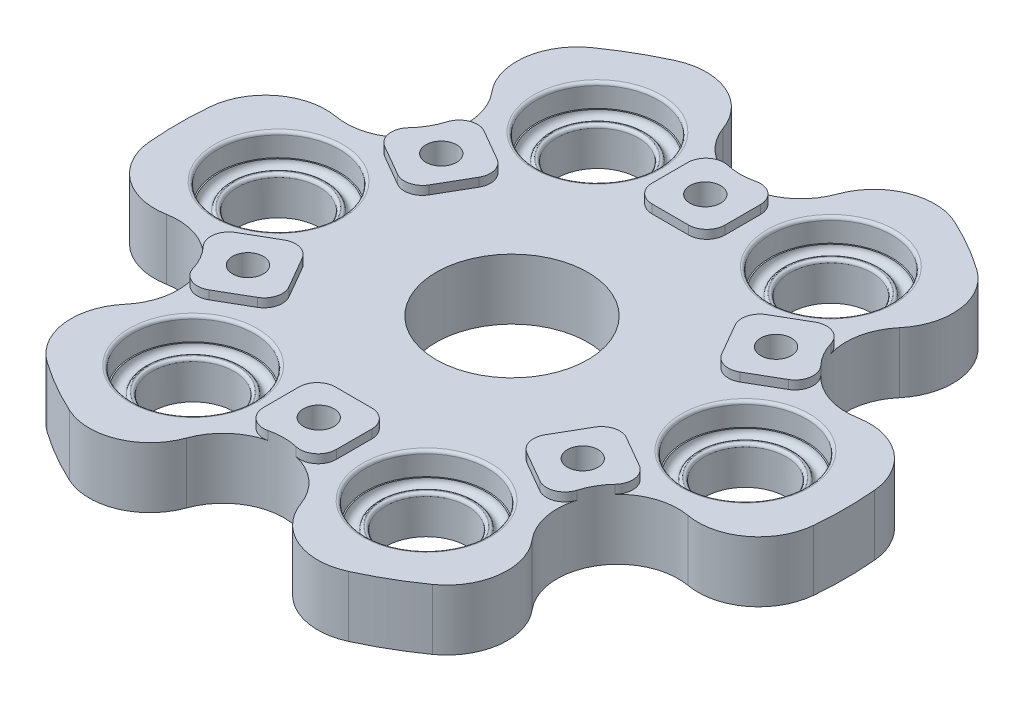
from build123d import *

# Parameters (mm, degrees)
SKETCH1_R                = 55
BOSS_EXTRUDE1_DEPTH      = 10
FILLET1_R                = 0.5
SKETCH5_R                = 10.000000000000005
SKETCH5_R_2              = 10.000000000000002
SKETCH5_R_3              = 12.5
CUT_EXTRUDE1_DEPTH       = 10
FILLET2_R                = 10
BOSS_EXTRUDE2_START      = 1.43
BOSS_EXTRUDE2_DEPTH      = 1.43
CUT_EXTRUDE2_DEPTH       = 3.5
FILLET3_R                = 3
CIRPATTERN1_COUNT        = 6
FILLET3_OF_CIRPATTERN1_R = 3


# Read off the part's stored shape, not the designer's step: Sketch-Pattern1
with BuildPart() as part:
    # Sketch1 → Boss-Extrude1 (new body)
    with BuildSketch(Plane(origin=(0, 0, 0), x_dir=(1, 0, 0), z_dir=(0, 1, 0))):
        with Locations(Location((0, 0, 0), (0, 0, 270))):
            Circle(SKETCH1_R)
    extrude(amount=BOSS_EXTRUDE1_DEPTH)

    # Sketch3 → Cut-Revolve3 (revolve, cut)
    with BuildSketch(Plane(origin=(19.247414599109128, 0, 0), x_dir=(0, 0, -1), z_dir=(1, 0, 0))):
        with BuildLine():
            Line((-33.33749999999999, 10), (-33.33749999999999, -2.082e-14))
            Line((-33.33749999999999, -2.082e-14), (-40.087499999999984, 3.47e-15))
            Line((-40.087499999999984, 3.47e-15), (-40.087499999999984, 6.25))
            Line((-40.087499999999984, 6.25), (-41.087499999999984, 6.25))
            ThreePointArc((-41.087499999999984, 6.25), (-42.13749999999998, 5.199999999999996), (-43.187499999999986, 6.25))
            Line((-43.187499999999986, 6.25), (-43.38749999999998, 6.249999999999999))
            Line((-43.38749999999998, 6.249999999999999), (-43.38749999999999, 10))
            Line((-43.38749999999999, 10), (-40.087499999999984, 9.999999999999972))
            Line((-40.087499999999984, 9.999999999999972), (-33.33749999999999, 10))
        make_face()
    revolve(axis=Axis((19.247414599109128, 10, 33.33749999999999), (0, -1, 0)), mode=Mode.SUBTRACT)

    # Fillet1
    fillet1_edges = [part.edges().sort_by_distance(p)[0] for p in [
        (19.247414599109128, 10, 23.287499999999994),
        (19.247414599109128, 6.25, 25.5875),
        (19.247414599109128, 6.25, 26.5875),
    ]]
    fillet(fillet1_edges, radius=FILLET1_R)

    # Sketch-Pattern1 outline → Sketch-Pattern1 (revolve, cut)
    with BuildSketch(Plane(origin=(-19.247414599, 0, -33.3375), x_dir=(1, 0, 0), z_dir=(0, 0, 1))):
        with BuildLine():
            ThreePointArc((7.806130917, 5.911290323), (8.97166459, 5.214127774), (9.85, 6.25))
            Line((9.85, 6.25), (10.05, 6.25))
            Line((10.05, 6.25), (10.05, 9.5))
            ThreePointArc((10.05, 9.5), (10.196446609, 9.853553391), (10.55, 10))
            Line((10.55, 10), (0, 10))
            Line((0, 10), (0, 0))
            Line((0, 0), (6.75, 0))
            Line((6.75, 0), (6.75, 5.75))
            ThreePointArc((6.75, 5.75), (6.896446609, 6.103553391), (7.25, 6.25))
            Line((7.25, 6.25), (7.332859925, 6.25))
            ThreePointArc((7.332859925, 6.25), (7.623853773, 6.156598796), (7.806130917, 5.911290323))
        make_face()
    revolve(axis=Axis((-19.247414599, 0, -33.3375), (0, 1, 0)), mode=Mode.SUBTRACT)

    # Sketch-Pattern1 2 outline → Sketch-Pattern1 2 (revolve, cut)
    with BuildSketch(Plane(origin=(19.247414599, 0, -33.3375), x_dir=(1, 0, 0), z_dir=(0, 0, 1))):
        with BuildLine():
            ThreePointArc((7.806130917, 5.911290323), (8.97166459, 5.214127774), (9.85, 6.25))
            Line((9.85, 6.25), (10.05, 6.25))
            Line((10.05, 6.25), (10.05, 9.5))
            ThreePointArc((10.05, 9.5), (10.196446609, 9.853553391), (10.55, 10))
            Line((10.55, 10), (0, 10))
            Line((0, 10), (0, 0))
            Line((0, 0), (6.75, 0))
            Line((6.75, 0), (6.75, 5.75))
            ThreePointArc((6.75, 5.75), (6.896446609, 6.103553391), (7.25, 6.25))
            Line((7.25, 6.25), (7.332859925, 6.25))
            ThreePointArc((7.332859925, 6.25), (7.623853773, 6.156598796), (7.806130917, 5.911290323))
        make_face()
    revolve(axis=Axis((19.247414599, 0, -33.3375), (0, 1, 0)), mode=Mode.SUBTRACT)

    # Sketch-Pattern1 3 outline → Sketch-Pattern1 3 (revolve, cut)
    with BuildSketch(Plane(origin=(38.494829198, 0, 0), x_dir=(1, 0, 0), z_dir=(0, 0, 1))):
        with BuildLine():
            ThreePointArc((7.806130917, 5.911290323), (8.97166459, 5.214127774), (9.85, 6.25))
            Line((9.85, 6.25), (10.05, 6.25))
            Line((10.05, 6.25), (10.05, 9.5))
            ThreePointArc((10.05, 9.5), (10.196446609, 9.853553391), (10.55, 10))
            Line((10.55, 10), (0, 10))
            Line((0, 10), (0, 0))
            Line((0, 0), (6.75, 0))
            Line((6.75, 0), (6.75, 5.75))
            ThreePointArc((6.75, 5.75), (6.896446609, 6.103553391), (7.25, 6.25))
            Line((7.25, 6.25), (7.332859925, 6.25))
            ThreePointArc((7.332859925, 6.25), (7.623853773, 6.156598796), (7.806130917, 5.911290323))
        make_face()
    revolve(axis=Axis((38.494829198, 0, 0), (0, 1, 0)), mode=Mode.SUBTRACT)

    # Sketch-Pattern1 4 outline → Sketch-Pattern1 4 (revolve, cut)
    with BuildSketch(Plane(origin=(-19.247414599, 0, 33.3375), x_dir=(1, 0, 0), z_dir=(0, 0, 1))):
        with BuildLine():
            ThreePointArc((7.806130917, 5.911290323), (8.97166459, 5.214127774), (9.85, 6.25))
            Line((9.85, 6.25), (10.05, 6.25))
            Line((10.05, 6.25), (10.05, 9.5))
            ThreePointArc((10.05, 9.5), (10.196446609, 9.853553391), (10.55, 10))
            Line((10.55, 10), (0, 10))
            Line((0, 10), (0, 0))
            Line((0, 0), (6.75, 0))
            Line((6.75, 0), (6.75, 5.75))
            ThreePointArc((6.75, 5.75), (6.896446609, 6.103553391), (7.25, 6.25))
            Line((7.25, 6.25), (7.332859925, 6.25))
            ThreePointArc((7.332859925, 6.25), (7.623853773, 6.156598796), (7.806130917, 5.911290323))
        make_face()
    revolve(axis=Axis((-19.247414599, 0, 33.3375), (0, 1, 0)), mode=Mode.SUBTRACT)

    # Sketch-Pattern1 5 outline → Sketch-Pattern1 5 (revolve, cut)
    with BuildSketch(Plane(origin=(-38.494829198, 0, 0), x_dir=(1, 0, 0), z_dir=(0, 0, 1))):
        with BuildLine():
            ThreePointArc((7.806130917, 5.911290323), (8.97166459, 5.214127774), (9.85, 6.25))
            Line((9.85, 6.25), (10.05, 6.25))
            Line((10.05, 6.25), (10.05, 9.5))
            ThreePointArc((10.05, 9.5), (10.196446609, 9.853553391), (10.55, 10))
            Line((10.55, 10), (0, 10))
            Line((0, 10), (0, 0))
            Line((0, 0), (6.75, 0))
            Line((6.75, 0), (6.75, 5.75))
            ThreePointArc((6.75, 5.75), (6.896446609, 6.103553391), (7.25, 6.25))
            Line((7.25, 6.25), (7.332859925, 6.25))
            ThreePointArc((7.332859925, 6.25), (7.623853773, 6.156598796), (7.806130917, 5.911290323))
        make_face()
    revolve(axis=Axis((-38.494829198, 0, 0), (0, 1, 0)), mode=Mode.SUBTRACT)

    # Sketch5 → Cut-Extrude1 (cut)
    with BuildSketch(Plane(origin=(0, 10, 0), x_dir=(1, 0, 0), z_dir=(0, 1, 0))):
        with Locations((1.392e-14, 47.625)):
            Circle(SKETCH5_R)
        with Locations((-41.244459855233885, 23.812500000000014)):
            Circle(SKETCH5_R_2)
        with Locations((-41.244459855233885, -23.812499999999986)):
            Circle(SKETCH5_R_2)
        with Locations((-2.084e-14, -47.625)):
            Circle(SKETCH5_R)
        with Locations((41.24445985523388, -23.81250000000002)):
            Circle(SKETCH5_R_2)
        with Locations((41.24445985523388, 23.812500000000007)):
            Circle(SKETCH5_R_2)
        with Locations(Location((0, 0, 0), (0, 0, 270))):
            Circle(SKETCH5_R_3)
    extrude(amount=-CUT_EXTRUDE1_DEPTH, mode=Mode.SUBTRACT)

    # Fillet2
    fillet2_edges = [part.edges().sort_by_distance(p)[0] for p in [
        (7.241751011062745, 5, -54.52116141732284),
        (-7.241751011062713, 5, -54.52116141732284),
        (50.837586336764886, 5, -20.989040365199546),
        (43.59583532570225, 5, -33.53212105212332),
        (43.59583532570218, 5, 33.53212105212341),
        (50.837586336764915, 5, 20.989040365199482),
        (-7.241751011062753, 5, 54.52116141732284),
        (7.241751011062706, 5, 54.52116141732284),
        (-50.83758633676489, 5, 20.989040365199525),
        (-43.595835325702254, 5, 33.5321210521233),
        (-43.59583532570219, 5, -33.5321210521234),
        (-50.83758633676492, 5, -20.989040365199475),
    ]]
    fillet(fillet2_edges, radius=FILLET2_R)

    # Sketch6 → Boss-Extrude2 (add)
    with BuildSketch(Plane(origin=(0, 10, 0), x_dir=(1, 0, 0), z_dir=(0, 1, 0)).offset(BOSS_EXTRUDE2_START)):
        with BuildLine():
            Line((-5.999999999999988, 39.62499999999999), (-5.999999999999987, 26.124999999999996))
            Line((-5.999999999999987, 26.124999999999996), (6.000000000000014, 26.124999999999996))
            Line((6.000000000000014, 26.124999999999996), (6.000000000000016, 39.62499999999999))
            ThreePointArc((6.000000000000016, 39.62499999999999), (1.453e-14, 37.62499999999999), (-5.999999999999988, 39.62499999999999))
        make_face()
    boss_extrude2 = extrude(amount=-BOSS_EXTRUDE2_DEPTH)

    # Sketch8 → #8 (0.199) Diameter Hole1 (revolve, cut)
    with BuildSketch(Plane(origin=(1.298e-14, 11.43, -31.874999999999993), x_dir=(0, 0, 1), z_dir=(1, 0, 0))):
        Polygon((0, 0), (-3.47e-15, 15), (2.5272999999999968, 13.481444957531645), (2.5272999999999985, 1e-16), align=None)
    f_8_0_199_diameter_hole1 = revolve(axis=Axis((1.298e-14, 17.77999999999999, -31.874999999999993), (0, -1, 0)), mode=Mode.SUBTRACT)

    # Sketch9 → Cut-Extrude2 (cut)
    with BuildSketch(Plane.XZ):
        Polygon((2.5836424546235937, -36.349999999999994), (5.167284909247167, -31.875), (2.5836424546235865, -27.399999999999995), (-2.5836424546235617, -27.399999999999995), (-5.167284909247135, -31.874999999999993), (-2.5836424546235577, -36.349999999999994), align=None)
    cut_extrude2 = extrude(amount=-CUT_EXTRUDE2_DEPTH, mode=Mode.SUBTRACT)

    # Fillet3
    fillet3_edges = [part.edges().sort_by_distance(p)[0] for p in [
        (6.000000000000016, 10.715, -39.62499999999999),
        (-5.999999999999988, 10.715, -39.62499999999999),
        (-5.999999999999987, 10.715, -26.124999999999996),
        (6.000000000000014, 10.715, -26.124999999999996),
    ]]
    fillet(fillet3_edges, radius=FILLET3_R)

    # CirPattern1: Boss-Extrude2, #8 (0.199) Diameter Hole1, Cut-Extrude2 ×6 about axis
    cirpattern1_axis = Axis((-3.306e-14, 0, 5.35e-15), (0, 1, 0))
    add([boss_extrude2.rotate(cirpattern1_axis, i * 360 / CIRPATTERN1_COUNT) for i in range(1, CIRPATTERN1_COUNT)])
    add([f_8_0_199_diameter_hole1.rotate(cirpattern1_axis, i * 360 / CIRPATTERN1_COUNT) for i in range(1, CIRPATTERN1_COUNT)], mode=Mode.SUBTRACT)
    add([cut_extrude2.rotate(cirpattern1_axis, i * 360 / CIRPATTERN1_COUNT) for i in range(1, CIRPATTERN1_COUNT)], mode=Mode.SUBTRACT)

    # Fillet3 of CirPattern1
    fillet3_of_cirpattern1_edges = [part.edges().sort_by_distance(p)[0] for p in [
        (-31.316256624958385, 10.715, -25.00865242270667),
        (-37.316256624958385, 10.715, -14.616347577293405),
        (-25.62491367386847, 10.715, -7.866347577293407),
        (-19.62491367386847, 10.715, -18.25865242270667),
        (-37.31625662495844, 10.715, 14.616347577293322),
        (-31.316256624958438, 10.715, 25.00865242270659),
        (-19.62491367386852, 10.715, 18.258652422706593),
        (-25.62491367386852, 10.715, 7.866347577293328),
        (-6.000000000000086, 10.715, 39.62500000000001),
        (5.999999999999917, 10.715, 39.62500000000001),
        (5.999999999999917, 10.715, 26.125000000000007),
        (-6.0000000000000835, 10.715, 26.125000000000007),
        (31.316256624958307, 10.715, 25.008652422706696),
        (37.316256624958314, 10.715, 14.616347577293432),
        (25.6249136738684, 10.715, 7.866347577293428),
        (19.62491367386839, 10.715, 18.25865242270669),
        (37.31625662495836, 10.715, -14.616347577293322),
        (31.316256624958367, 10.715, -25.00865242270659),
        (19.624913673868452, 10.715, -18.25865242270659),
        (25.624913673868452, 10.715, -7.866347577293327),
    ]]
    fillet(fillet3_of_cirpattern1_edges, radius=FILLET3_OF_CIRPATTERN1_R)


solid = part.part
